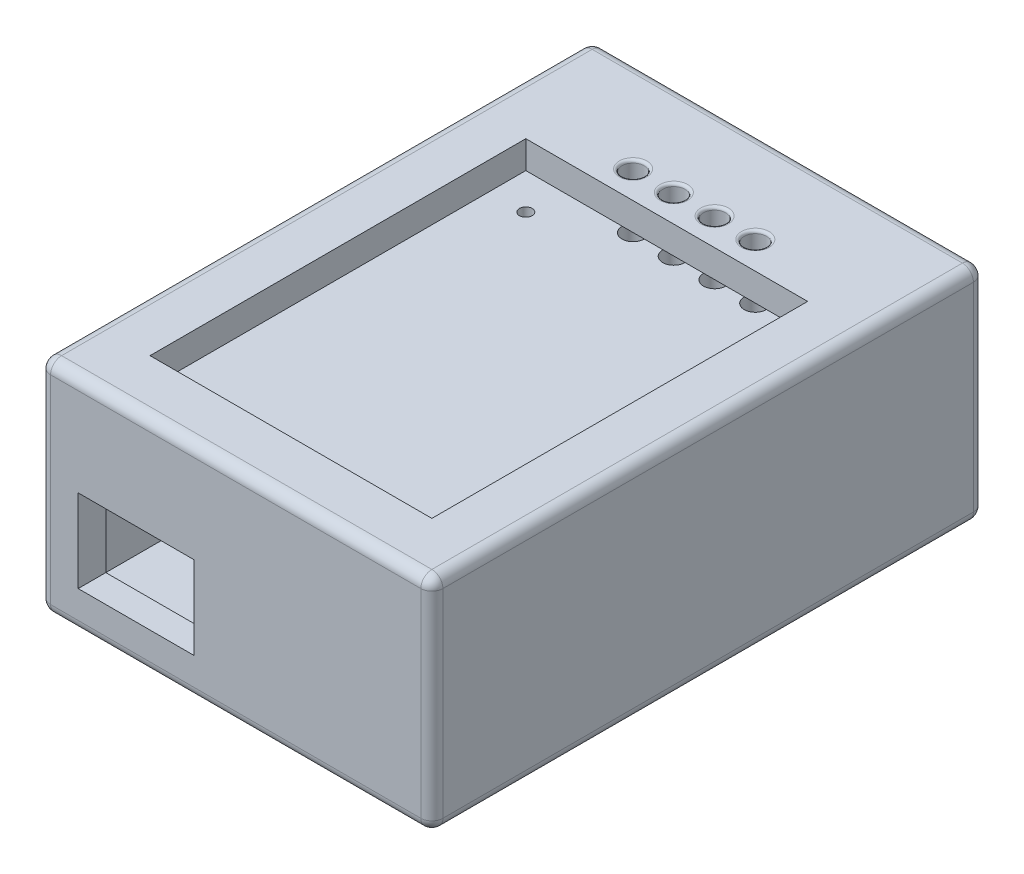
from build123d import *

# Parameters (mm, degrees)
SKETCH1_W           = 71
SKETCH1_H           = 100
BOSS_EXTRUDE1_DEPTH = 30
SHELL3_T            = -5
SKETCH3_W           = 71
SKETCH3_H           = 100
BOSS_EXTRUDE2_DEPTH = 5
SKETCH4_W           = 51
SKETCH4_H           = 68
CUT_EXTRUDE2_DEPTH  = 5
SKETCH1_2_W         = 71
SKETCH1_2_H         = 100
BOSS_EXTRUDE3_DEPTH = 10
SKETCH10_W          = 61
SKETCH10_H          = 90
CUT_EXTRUDE6_DEPTH  = 20
SKETCH10_2_W        = 61
SKETCH10_2_H        = 90
BOSS_EXTRUDE4_DEPTH = 5
SKETCH12_W          = 100
SKETCH12_H          = 5
BOSS_EXTRUDE5_DEPTH = 71
SKETCH5_R           = 2
CUT_EXTRUDE3_DEPTH  = 25
CUT_EXTRUDE7_START  = 2
SKETCH13_R          = 1.15
CUT_EXTRUDE7_DEPTH  = 5
SKETCH14_W          = 21
SKETCH14_H          = 15
CUT_EXTRUDE8_DEPTH  = 5
CUT_EXTRUDE9_START  = -2
SKETCH15_R          = 1.15
CUT_EXTRUDE9_DEPTH  = 3
SKETCH16_W          = 28
SKETCH16_H          = 10
CUT_EXTRUDE10_DEPTH = 10
FILLET1_R           = 2
FILLET2_R           = 2
FILLET5_R           = 0.5


with BuildPart() as part:
    # Sketch1 → Boss-Extrude1 (new body)
    with BuildSketch(Plane(origin=(0, 0, 0), x_dir=(1, 0, 0), z_dir=(0, 1, 0))):
        Rectangle(SKETCH1_W, SKETCH1_H)
    extrude(amount=BOSS_EXTRUDE1_DEPTH)

    # Shell3
    shell3_openings = [part.faces().sort_by_distance(p)[0] for p in [
        (0, 30, 0),
    ]]
    offset(amount=SHELL3_T, openings=shell3_openings, kind=Kind.INTERSECTION)

    # Sketch3 → Boss-Extrude2 (add)
    with BuildSketch(Plane(origin=(0, 30, 0), x_dir=(1, 0, 0), z_dir=(0, 1, 0))):
        Rectangle(SKETCH3_W, SKETCH3_H)
    extrude(amount=-BOSS_EXTRUDE2_DEPTH)

    # Sketch4 → Cut-Extrude2 (cut)
    with BuildSketch(Plane(origin=(0, 30, 0), x_dir=(1, 0, 0), z_dir=(0, 1, 0))):
        with Locations((0, -6)):
            Rectangle(SKETCH4_W, SKETCH4_H)
    extrude(amount=-CUT_EXTRUDE2_DEPTH, mode=Mode.SUBTRACT)

    # Sketch1<2> → Boss-Extrude3 (add)
    with BuildSketch(Plane(origin=(0, 0, 0), x_dir=(1, 0, 0), z_dir=(0, 1, 0))):
        Rectangle(SKETCH1_2_W, SKETCH1_2_H)
    extrude(amount=-BOSS_EXTRUDE3_DEPTH)

    # Sketch10 → Cut-Extrude6 (cut)
    with BuildSketch(Plane.XZ.offset(10)):
        Rectangle(SKETCH10_W, SKETCH10_H)
    extrude(amount=-CUT_EXTRUDE6_DEPTH, mode=Mode.SUBTRACT)

    # Sketch10<2> → Boss-Extrude4 (add)
    with BuildSketch(Plane.XZ.offset(10)):
        Rectangle(SKETCH10_2_W, SKETCH10_2_H)
    extrude(amount=-BOSS_EXTRUDE4_DEPTH)

    # Sketch12 → Boss-Extrude5 (add)
    with BuildSketch(Plane(origin=(35.5, 0, 0), x_dir=(0, 0, -1), z_dir=(1, 0, 0))):
        with Locations((0, 17.5)):
            Rectangle(SKETCH12_W, SKETCH12_H)
    extrude(amount=-BOSS_EXTRUDE5_DEPTH)

    # Sketch5 → Cut-Extrude3 (cut)
    with BuildSketch(Plane(origin=(0, 30, 0), x_dir=(1, 0, 0), z_dir=(0, 1, 0))):
        with Locations(Location((-11.055, 32.97, 0), (0, 0, 270))):
            Circle(SKETCH5_R)
        with Locations(Location((-3.685, 32.97, 0), (0, 0, 270))):
            Circle(SKETCH5_R)
        with Locations(Location((3.685, 32.97, 0), (0, 0, 270))):
            Circle(SKETCH5_R)
        with Locations(Location((11.055, 32.97, 0), (0, 0, 270))):
            Circle(SKETCH5_R)
    extrude(amount=-CUT_EXTRUDE3_DEPTH, mode=Mode.SUBTRACT)

    # Sketch13 → Cut-Extrude7 (cut)
    with BuildSketch(Plane(origin=(0, 20, 0), x_dir=(1, 0, 0), z_dir=(0, 1, 0)).offset(CUT_EXTRUDE7_START)):
        with Locations(Location((-24, 26.5, 0), (0, 0, 270))):
            Circle(SKETCH13_R)
        with Locations(Location((24, 26.5, 0), (0, 0, 270))):
            Circle(SKETCH13_R)
        with Locations(Location((24, -34.5, 0), (0, 0, 270))):
            Circle(SKETCH13_R)
        with Locations(Location((-24, -34.5, 0), (0, 0, 270))):
            Circle(SKETCH13_R)
    extrude(amount=-CUT_EXTRUDE7_DEPTH, mode=Mode.SUBTRACT)

    # Sketch14 → Cut-Extrude8 (cut)
    with BuildSketch(Plane.XY.offset(50)):
        with Locations((-18, 4.5)):
            Rectangle(SKETCH14_W, SKETCH14_H)
    extrude(amount=-CUT_EXTRUDE8_DEPTH, mode=Mode.SUBTRACT)

    # Sketch15 → Cut-Extrude9 (cut)
    with BuildSketch(Plane.XZ.offset(10).offset(CUT_EXTRUDE9_START)):
        with Locations(Location((28, -36.04, 0), (0, 0, 270))):
            Circle(SKETCH15_R)
        with Locations(Location((-28, -36.04, 0), (0, 0, 270))):
            Circle(SKETCH15_R)
        with Locations(Location((28, 28.5, 0), (0, 0, 270))):
            Circle(SKETCH15_R)
        with Locations(Location((-28, 28.5, 0), (0, 0, 270))):
            Circle(SKETCH15_R)
    extrude(amount=-CUT_EXTRUDE9_DEPTH, mode=Mode.SUBTRACT)

    # Sketch16 → Cut-Extrude10 (cut)
    with BuildSketch(Plane(origin=(0, 20, 0), x_dir=(1, 0, 0), z_dir=(0, 1, 0))):
        with Locations((0, -35)):
            Rectangle(SKETCH16_W, SKETCH16_H)
    extrude(amount=-CUT_EXTRUDE10_DEPTH, mode=Mode.SUBTRACT)

    # Fillet1
    fillet1_edges = [part.edges().sort_by_distance(p)[0] for p in [
        (-35.5, 30, 0),
        (35.5, 30, 0),
        (35.5, -10, 0),
        (0, -10, 50),
        (-35.5, -10, 0),
        (0, -10, -50),
        (0, 30, -50),
        (35.5, 10, 50),
        (-35.5, 10, 50),
        (-35.5, 10, -50),
        (35.5, 10, -50),
    ]]
    fillet(fillet1_edges, radius=FILLET1_R)

    # Fillet2
    # the kernel refuses this fillet: 2 mm, written as the material it takes off along each edge
    with BuildSketch(Plane(origin=(33.5, 28, 48), x_dir=(0, 0, 1), z_dir=(0, 1, 0))) as fillet2_piece_1_section:
        Polygon((0, 0), (FILLET2_R, 0), (FILLET2_R, FILLET2_R), (0, FILLET2_R), align=None)
    fillet2_piece_1 = extrude(amount=FILLET2_R, mode=Mode.PRIVATE)
    fillet2_piece_1 = fillet2_piece_1 - Plane(origin=(33.5, 28, 48), x_dir=(-0.7071067811865476, 0, -0.7071067811865475), z_dir=(0, 1, 0)) * Sphere(FILLET2_R, mode=Mode.PRIVATE)
    add(fillet2_piece_1, mode=Mode.SUBTRACT)
    with BuildSketch(Plane(origin=(-33.5, 28, 48), x_dir=(0, 0, 1), z_dir=(0, 1, 0))) as fillet2_piece_2_section:
        Polygon((0, 0), (FILLET2_R, 0), (FILLET2_R, -FILLET2_R), (0, -FILLET2_R), align=None)
    fillet2_piece_2 = extrude(amount=FILLET2_R, mode=Mode.PRIVATE)
    fillet2_piece_2 = fillet2_piece_2 - Plane(origin=(-33.5, 28, 48), x_dir=(0.7071067811865475, 0, -0.7071067811865477), z_dir=(0, 1, 0)) * Sphere(FILLET2_R, mode=Mode.PRIVATE)
    add(fillet2_piece_2, mode=Mode.SUBTRACT)
    with BuildSketch(Plane(origin=(33.5, 30, 50), x_dir=(0, 0, -1), z_dir=(-1, 0, 0))) as fillet2_piece_3:
        with BuildLine():
            CenterArc((FILLET2_R, FILLET2_R), FILLET2_R, 180, 90)
            Line((0, FILLET2_R), (0, 0))
            Line((0, 0), (FILLET2_R, 0))
        make_face()
    extrude(amount=67, mode=Mode.SUBTRACT)

    # Fillet5
    fillet5_edges = [part.edges().sort_by_distance(p)[0] for p in [
        (11.055, 30, -34.97),
        (3.685, 30, -34.97),
        (-11.055, 30, -34.97),
        (-3.685, 30, -34.97),
    ]]
    fillet(fillet5_edges, radius=FILLET5_R)


solid = part.part
